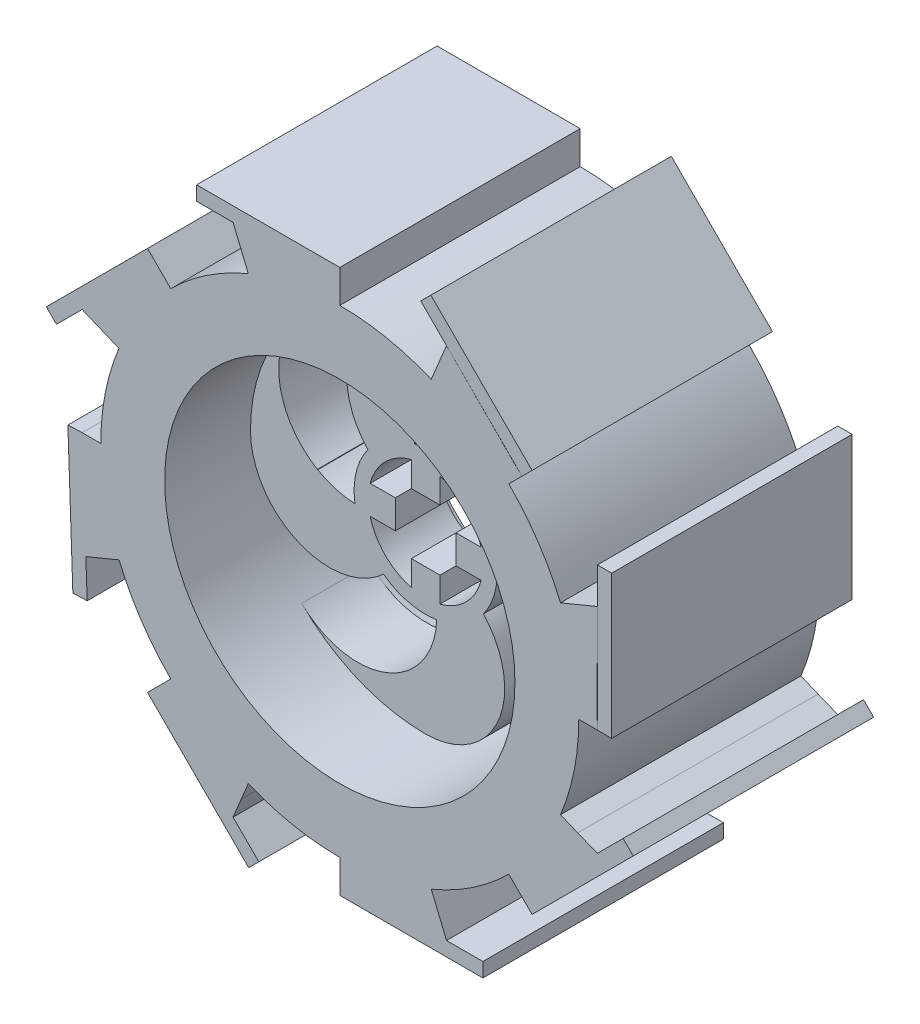
from build123d import *

# Parameters (mm, degrees)
BOSS_EXTRUDE1_DEPTH  = 84
CLEATS_START         = -84
SKETCH13_W           = 5
SKETCH13_H           = 50
SKETCH13_W_2         = 50
SKETCH13_H_2         = 5
CLEATS_DEPTH         = 84
CLEATS_2_DEPTH       = 84
SKETCH15_R           = 61.2
SKETCH15_R_2         = 20
MIDDLE_CUT_DEPTH     = 84
BOSS_EXTRUDE13_DEPTH = 84
SKETCH18_R           = 61.2
WHEEL_CUT1_DEPTH     = 30
SKETCH19_R           = 61.2
WHEEL_CUT2_DEPTH     = 30
SKETCH20_R           = 25
BOSS_EXTRUDE14_DEPTH = 24
CUT_EXTRUDE4_DEPTH   = 84


with BuildPart() as part:
    # Sketch1 → Boss-Extrude1 (new body)
    with BuildSketch(Plane.XY):
        with BuildLine():
            Line((0, 83.5), (0, 90))
            ThreePointArc((0, 90), (-17.563832105, 88.269540623), (-34.452253143, 83.144706707))
            Line((-34.452253143, 83.144706707), (-31.964034861, 77.139811222))
            ThreePointArc((-31.964034861, 77.139811222), (-46.394600078, 69.424715222), (-59.043416229, 59.043416229))
            Line((-59.043416229, 59.043416229), (-63.639610307, 63.639610307))
            ThreePointArc((-63.639610307, 63.639610307), (-74.841789746, 49.987063402), (-83.162275131, 34.409824105))
            Line((-83.162275131, 34.409824105), (-77.156110816, 31.924670142))
            ThreePointArc((-77.156110816, 31.924670142), (-81.898672923, 16.274439266), (-83.5, 0))
            Line((-83.5, 0), (-90, 0))
            ThreePointArc((-90, 0), (-88.260943117, -17.606984978), (-83.110979555, -34.533535547))
            Line((-83.110979555, -34.533535547), (-77.108519921, -32.039446869))
            ThreePointArc((-77.108519921, -32.039446869), (-69.402024608, -46.428536272), (-59.043416229, -59.043416229))
            Line((-59.043416229, -59.043416229), (-63.639610307, -63.639610307))
            ThreePointArc((-63.639610307, -63.639610307), (-50.006155773, -74.829034371), (-34.452253143, -83.144706707))
            Line((-34.452253143, -83.144706707), (-31.964034861, -77.139811222))
            ThreePointArc((-31.964034861, -77.139811222), (-16.295333119, -81.894518245), (0, -83.5))
            Line((0, -83.5), (0, -90))
            ThreePointArc((0, -90), (17.563832105, -88.269540623), (34.452253143, -83.144706707))
            Line((34.452253143, -83.144706707), (31.964034861, -77.139811222))
            ThreePointArc((31.964034861, -77.139811222), (46.394600078, -69.424715222), (59.043416229, -59.043416229))
            Line((59.043416229, -59.043416229), (63.639610307, -63.639610307))
            ThreePointArc((63.639610307, -63.639610307), (74.804577421, -50.042733706), (83.110979555, -34.533535547))
            Line((83.110979555, -34.533535547), (77.108519921, -32.039446869))
            ThreePointArc((77.108519921, -32.039446869), (81.88654167, -16.335369396), (83.5, 0))
            Line((83.5, 0), (90, 0))
            ThreePointArc((90, 0), (88.259244876, 17.615495846), (83.104317913, 34.549563588))
            Line((83.104317913, 34.549563588), (77.102339397, 32.054317329))
            ThreePointArc((77.102339397, 32.054317329), (69.397547209, 46.435228452), (59.043416229, 59.043416229))
            Line((59.043416229, 59.043416229), (63.639610307, 63.639610307))
            ThreePointArc((63.639610307, 63.639610307), (50.006155773, 74.829034371), (34.452253143, 83.144706707))
            Line((34.452253143, 83.144706707), (31.964034861, 77.139811222))
            ThreePointArc((31.964034861, 77.139811222), (16.295333119, 81.894518245), (0, 83.5))
        make_face()
    extrude(amount=BOSS_EXTRUDE1_DEPTH)

    # Sketch13 → Cleats (add)
    with BuildSketch(Plane.XY.offset(84).offset(CLEATS_START)):
        with Locations((92.5, 25)):
            Rectangle(SKETCH13_W, SKETCH13_H)
        Polygon((28.284271247, 98.994949366), (63.639610307, 63.639610307), (67.175144213, 67.175144213), (31.819805153, 102.530483272), align=None)
        with Locations((-25, 92.5)):
            Rectangle(SKETCH13_W_2, SKETCH13_H_2)
        Polygon((-98.994949366, 28.284271247), (-63.639610307, 63.639610307), (-67.175144213, 67.175144213), (-102.530483272, 31.819805153), align=None)
        with BuildLine():
            ThreePointArc((-89.782512145, -6.253040302), (-89.945611602, -3.128410698), (-90, 0))
            Line((-90, 0), (-95, -0.173905688))
            Line((-95, -0.173905688), (-93.260943117, -50.173905688))
            Line((-93.260943117, -50.173905688), (-88.260943117, -50))
            Line((-88.260943117, -50), (-89.782512145, -6.253040302))
        make_face()
        Polygon((-28.284271247, -98.994949366), (-63.639610307, -63.639610307), (-67.175144213, -67.175144213), (-31.819805153, -102.530483272), align=None)
        with Locations((25, -92.5)):
            Rectangle(SKETCH13_W_2, SKETCH13_H_2)
        Polygon((98.994949366, -28.284271247), (63.639610307, -63.639610307), (67.175144213, -67.175144213), (102.530483272, -31.819805153), align=None)
    extrude(amount=CLEATS_DEPTH)


with BuildPart() as cleats_piece_1:
    # of the separate pieces the step leaves, piece 1, a body of its own (cleats_pieces)
    add(part.part.solids().sort_by_distance((31.964034861, -77.139811222, 0))[0])



with BuildPart() as cleats_piece_2:
    # of the separate pieces the step leaves, piece 2, a body of its own (cleats_pieces)
    add(part.part.solids().sort_by_distance((-28.284271247, -98.994949366, 0))[0])


with BuildPart() as cleats_piece_3:
    # of the separate pieces the step leaves, piece 3, a body of its own (cleats_pieces)
    add(part.part.solids().sort_by_distance((98.994949366, -28.284271247, 0))[0])


with BuildPart() as cleats_piece_4:
    # of the separate pieces the step leaves, piece 4, a body of its own (cleats_pieces)
    add(part.part.solids().sort_by_distance((-50, 90, 0))[0])


with BuildPart() as cleats_piece_5:
    # of the separate pieces the step leaves, piece 5, a body of its own (cleats_pieces)
    add(part.part.solids().sort_by_distance((90, 50, 0))[0])


with BuildPart() as cleats_piece_6:
    # of the separate pieces the step leaves, piece 6, a body of its own (cleats_pieces)
    add(part.part.solids().sort_by_distance((-98.994949366, 28.284271247, 0))[0])


with BuildPart() as cleats_piece_7:
    # of the separate pieces the step leaves, piece 7, a body of its own (cleats_pieces)
    add(part.part.solids().sort_by_distance((28.284271247, 98.994949366, 0))[0])


with BuildPart() as cleats_piece_8:
    # of the separate pieces the step leaves, piece 8, a body of its own (cleats_pieces)
    add(part.part.solids().sort_by_distance((50, -90, 0))[0])


with BuildPart() as cleats_piece_1_1:
    add(cleats_piece_1.part)

    add(cleats_piece_4.part)  # cleats_2 merges Cleats piece 4

    add(cleats_piece_6.part)  # cleats_2 merges Cleats piece 6

    add(cleats_piece_2.part)  # cleats_2 merges Cleats piece 2

    add(cleats_piece_8.part)  # cleats_2 merges Cleats piece 8

    add(cleats_piece_3.part)  # cleats_2 merges Cleats piece 3
    # Sketch14 → cleats_2 (add)
    with BuildSketch(Plane(origin=(0, 0, 0), x_dir=(-1, 0, 0), z_dir=(0, 0, -1))):
        with BuildLine():
            Line((-34.452253143, 83.144706707), (-37.288854525, 89.990366088))
            Line((-37.288854525, 89.990366088), (-61.078330233, 66.10172143))
            ThreePointArc((-61.078330233, 66.10172143), (-48.519469565, 75.801458252), (-34.452253143, 83.144706707))
        make_face()
        with BuildLine():
            Line((34.452253143, 83.144706707), (37.292846481, 90))
            Line((37.292846481, 90), (0, 90))
            ThreePointArc((0, 90), (17.563832105, 88.269540623), (34.452253143, 83.144706707))
        make_face()
        with BuildLine():
            Line((90.028413475, 37.250807139), (63.639610307, 63.639610307))
            ThreePointArc((63.639610307, 63.639610307), (74.841789746, 49.987063402), (83.162275131, 34.409824105))
            Line((83.162275131, 34.409824105), (90.028413475, 37.250807139))
        make_face()
        with BuildLine():
            ThreePointArc((89.782512145, -6.253040302), (87.595584768, -20.664305678), (83.110979555, -34.533535547))
            Line((83.110979555, -34.533535547), (88.71807442, -36.856919192))
            Line((88.71807442, -36.856919192), (89.782512145, -6.253040302))
        make_face()
        with BuildLine():
            Line((37.292846481, -89.986374133), (63.639610307, -63.639610307))
            ThreePointArc((63.639610307, -63.639610307), (50.006155773, -74.829034371), (34.452253143, -83.144706707))
            Line((34.452253143, -83.144706707), (37.292846481, -89.986374133))
        make_face()
        with BuildLine():
            Line((-37.292846481, -90), (0, -90))
            ThreePointArc((0, -90), (-17.563832105, -88.269540623), (-34.452253143, -83.144706707))
            Line((-34.452253143, -83.144706707), (-37.292846481, -90))
        make_face()
        with BuildLine():
            Line((-90, -37.279220614), (-63.639610307, -63.639610307))
            ThreePointArc((-63.639610307, -63.639610307), (-74.804577421, -50.042733706), (-83.110979555, -34.533535547))
            Line((-83.110979555, -34.533535547), (-90, -37.279220614))
        make_face()
        with BuildLine():
            Line((-90, 34.549563588), (-89.900752874, 4.225474262))
            ThreePointArc((-89.900752874, 4.225474262), (-87.821274347, 19.6830834), (-83.104317913, 34.549563588))
            Line((-83.104317913, 34.549563588), (-90, 37.416355744))
            Line((-90, 37.416355744), (-90, 34.549563588))
        make_face()
    extrude(amount=-CLEATS_2_DEPTH)

    # Sketch15 → Middle_cut (cut)
    with BuildSketch(Plane.XY.offset(84)):
        Circle(SKETCH15_R)
        Circle(SKETCH15_R_2, mode=Mode.SUBTRACT)
    extrude(amount=-MIDDLE_CUT_DEPTH, mode=Mode.SUBTRACT)


with BuildPart() as middle_cut_piece_1:
    # of the separate pieces the step leaves, piece 1, a body of its own (middle_cut_pieces)
    add(cleats_piece_1_1.part.solids().sort_by_distance((98.994949366, -28.284271247, 0))[0])



with BuildPart() as middle_cut_piece_2:
    # of the separate pieces the step leaves, piece 2, a body of its own (middle_cut_pieces)
    add(cleats_piece_1_1.part.solids().sort_by_distance((20, 0, 0))[0])


with BuildPart() as middle_cut_piece_1_1:
    add(middle_cut_piece_1.part)

    add(middle_cut_piece_2.part)  # Boss-Extrude13 merges Middle_cut piece 2
    # Sketch17 → Boss-Extrude13 (add)
    with BuildSketch(Plane(origin=(0, 0, 0), x_dir=(-1, 0, 0), z_dir=(0, 0, -1))):
        with BuildLine():
            ThreePointArc((3.560893817, 19.680448044), (10.821218323, 16.819668071), (16.434110434, 11.398246104))
            ThreePointArc((16.434110434, 11.398246104), (26.221625986, 42.240462075), (1.9e-08, 61.2))
            ThreePointArc((1.9e-08, 61.2), (-23.420226037, 56.5414274), (-43.274934986, 43.274935032))
            ThreePointArc((-43.274934986, 43.274935032), (-11.327027619, 48.410006719), (3.560893817, 19.680448044))
        make_face()
        with BuildLine():
            ThreePointArc((11.398143562, -16.434181553), (42.187287015, -26.239244767), (61.199897458, -0.112031687))
            ThreePointArc((61.199897458, -0.112031687), (56.562840024, 23.368464401), (43.274934911, 43.274935106))
            ThreePointArc((43.274934911, 43.274935106), (51.146803007, 20.305967602), (37.83487395, 0))
            ThreePointArc((37.83487395, 0), (37.893163173, -0.034665095), (37.951367081, -0.069473249))
            Line((37.951367081, -0.069473249), (37.717792865, -0.069045671))
            ThreePointArc((37.717792865, -0.069045671), (28.998051461, -3.359115257), (19.680448044, -3.560893817))
            ThreePointArc((19.680448044, -3.560893817), (16.819634311, -10.821270796), (11.398143562, -16.434181553))
        make_face()
        with BuildLine():
            ThreePointArc((-3.560893817, -19.680448044), (-10.821218323, -16.819668071), (-16.434110434, -11.398246104))
            ThreePointArc((-16.434110434, -11.398246104), (-26.22162598, -42.240462094), (2e-08, -61.2))
            ThreePointArc((2e-08, -61.2), (23.4202261, -56.541427373), (43.274935055, -43.274934963))
            ThreePointArc((43.274935055, -43.274934963), (11.327027663, -48.410006741), (-3.560893817, -19.680448044))
        make_face()
        with BuildLine():
            ThreePointArc((-19.680448044, 3.560893817), (-16.819668071, 10.821218323), (-11.398246104, 16.434110434))
            ThreePointArc((-11.398246104, 16.434110434), (-42.240462085, 26.221625983), (-61.2, -2e-09))
            ThreePointArc((-61.2, -2e-09), (-56.541427408, -23.420226016), (-43.274935079, -43.274934938))
            ThreePointArc((-43.274935079, -43.274934938), (-48.410006704, -11.327027589), (-19.680448044, 3.560893817))
        make_face()
    extrude(amount=-BOSS_EXTRUDE13_DEPTH)

    # Sketch18 → Wheel_cut1 (cut)
    with BuildSketch(Plane.XY.offset(84)):
        Circle(SKETCH18_R)
    extrude(amount=-WHEEL_CUT1_DEPTH, mode=Mode.SUBTRACT)

    # Sketch19 → wheel_cut2 (cut)
    with BuildSketch(Plane(origin=(0, 0, 0), x_dir=(-1, 0, 0), z_dir=(0, 0, -1))):
        Circle(SKETCH19_R)
    extrude(amount=-WHEEL_CUT2_DEPTH, mode=Mode.SUBTRACT)

    # Sketch20 → Boss-Extrude14 (add)
    with BuildSketch(Plane(origin=(0, 0, 30), x_dir=(-1, 0, 0), z_dir=(0, 0, -1))):
        Circle(SKETCH20_R)
    extrude(amount=-BOSS_EXTRUDE14_DEPTH)

    # Sketch21 → Cut-Extrude4 (cut)
    with BuildSketch(Plane(origin=(0, 0, 30), x_dir=(-1, 0, 0), z_dir=(0, 0, -1))):
        with BuildLine():
            Line((-10.6, 5), (-10.6, -5))
            Line((-10.6, -5), (-19.364916731, -5))
            ThreePointArc((-19.364916731, -5), (-14.142135624, -14.142135624), (-5, -19.364916731))
            Line((-5, -19.364916731), (-5, -10.6))
            Line((-5, -10.6), (5, -10.6))
            Line((5, -10.6), (5, -19.364916731))
            ThreePointArc((5, -19.364916731), (14.142135624, -14.142135624), (19.364916731, -5))
            Line((19.364916731, -5), (10.6, -5))
            Line((10.6, -5), (10.6, 5))
            Line((10.6, 5), (19.364916731, 5))
            ThreePointArc((19.364916731, 5), (14.142135624, 14.142135624), (5, 19.364916731))
            Line((5, 19.364916731), (5, 10.6))
            Line((5, 10.6), (-5, 10.6))
            Line((-5, 10.6), (-5, 19.364916731))
            ThreePointArc((-5, 19.364916731), (-14.142135624, 14.142135624), (-19.364916731, 5))
            Line((-19.364916731, 5), (-10.6, 5))
        make_face()
    extrude(amount=-CUT_EXTRUDE4_DEPTH, mode=Mode.SUBTRACT)


solid = Compound([cleats_piece_5.part, cleats_piece_7.part, middle_cut_piece_1_1.part])
